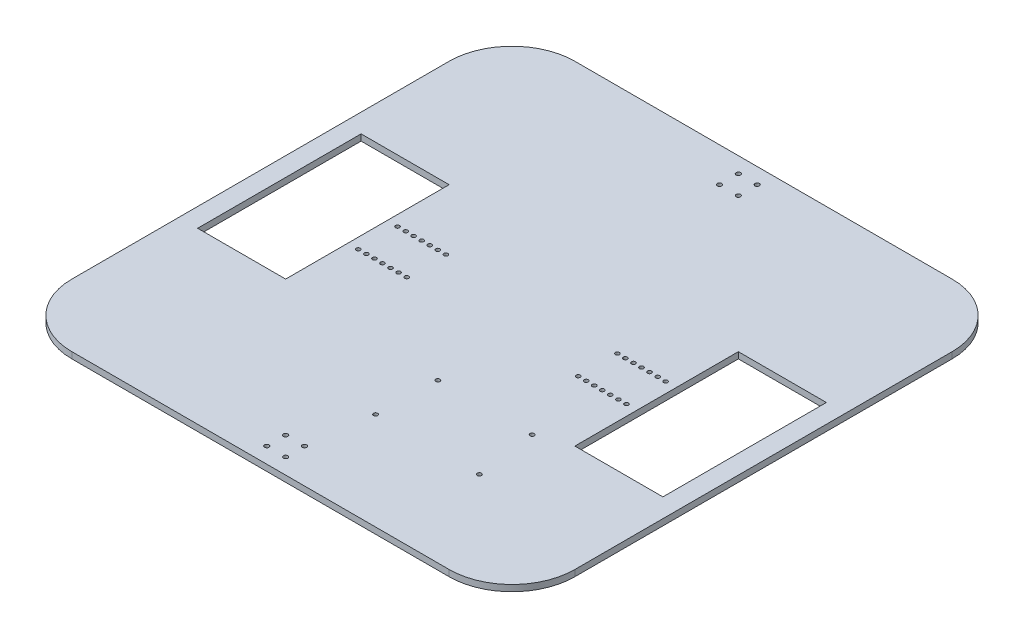
from build123d import *

# Parameters (mm, degrees)
SKETCH1_W           = 400
SKETCH1_H           = 400
SKETCH1_R           = 1.75
SKETCH1_W_2         = 70
SKETCH1_H_2         = 130
BOSS_EXTRUDE2_DEPTH = 5
FILLET1_R           = 50
SKETCH2_R           = 1.6
CUT_EXTRUDE1_DEPTH  = 5
SKETCH3_R           = 1.65
CUT_EXTRUDE2_DEPTH  = 10


with BuildPart() as part:
    # Sketch1 → Boss-Extrude2 (new body)
    with BuildSketch(Plane(origin=(0, 0, 0), x_dir=(1, 0, 0), z_dir=(0, 1, 0))):
        Rectangle(SKETCH1_W, SKETCH1_H)
        with Locations((-7.5, 172.5)):
            Circle(SKETCH1_R, mode=Mode.SUBTRACT)
        with Locations((-7.5, 187.5)):
            Circle(SKETCH1_R, mode=Mode.SUBTRACT)
        with Locations((7.5, 172.5)):
            Circle(SKETCH1_R, mode=Mode.SUBTRACT)
        with Locations((7.5, 187.5)):
            Circle(SKETCH1_R, mode=Mode.SUBTRACT)
        with Locations((-150, 0)):
            Rectangle(SKETCH1_W_2, SKETCH1_H_2, mode=Mode.SUBTRACT)
        with Locations((150, 0)):
            Rectangle(SKETCH1_W_2, SKETCH1_H_2, mode=Mode.SUBTRACT)
        with Locations((-7.5, -187.5)):
            Circle(SKETCH1_R, mode=Mode.SUBTRACT)
        with Locations((-7.5, -172.5)):
            Circle(SKETCH1_R, mode=Mode.SUBTRACT)
        with Locations((7.5, -187.5)):
            Circle(SKETCH1_R, mode=Mode.SUBTRACT)
        with Locations((7.5, -172.5)):
            Circle(SKETCH1_R, mode=Mode.SUBTRACT)
    extrude(amount=BOSS_EXTRUDE2_DEPTH)

    # Fillet1
    fillet1_edges = [part.edges().sort_by_distance(p)[0] for p in [
        (200, 2.5, -200),
        (200, 2.5, 200),
        (-200, 2.5, 200),
        (-200, 2.5, -200),
    ]]
    fillet(fillet1_edges, radius=FILLET1_R)

    # Sketch2 → Cut-Extrude1 (cut)
    with BuildSketch(Plane(origin=(0, 5, 0), x_dir=(1, 0, 0), z_dir=(0, 1, 0))):
        with Locations((-106.6, 15.6)):
            Circle(SKETCH2_R)
        with Locations((-100.2, 15.6)):
            Circle(SKETCH2_R)
        with Locations((-93.8, 15.6)):
            Circle(SKETCH2_R)
        with Locations((-87.4, 15.6)):
            Circle(SKETCH2_R)
        with Locations((-81, 15.6)):
            Circle(SKETCH2_R)
        with Locations((-74.6, 15.6)):
            Circle(SKETCH2_R)
        with Locations((-68.2, 15.6)):
            Circle(SKETCH2_R)
        with Locations((-68.2, -15.6)):
            Circle(SKETCH2_R)
        with Locations((-74.6, -15.6)):
            Circle(SKETCH2_R)
        with Locations((-81, -15.6)):
            Circle(SKETCH2_R)
        with Locations((-87.4, -15.6)):
            Circle(SKETCH2_R)
        with Locations((-93.8, -15.6)):
            Circle(SKETCH2_R)
        with Locations((-100.2, -15.6)):
            Circle(SKETCH2_R)
        with Locations((-106.6, -15.6)):
            Circle(SKETCH2_R)
        with Locations((68.2, -15.6)):
            Circle(SKETCH2_R)
        with Locations((74.6, -15.6)):
            Circle(SKETCH2_R)
        with Locations((81, -15.6)):
            Circle(SKETCH2_R)
        with Locations((87.4, -15.6)):
            Circle(SKETCH2_R)
        with Locations((93.8, -15.6)):
            Circle(SKETCH2_R)
        with Locations((100.2, -15.6)):
            Circle(SKETCH2_R)
        with Locations((106.6, -15.6)):
            Circle(SKETCH2_R)
        with Locations((68.2, 15.6)):
            Circle(SKETCH2_R)
        with Locations((74.6, 15.6)):
            Circle(SKETCH2_R)
        with Locations((81, 15.6)):
            Circle(SKETCH2_R)
        with Locations((87.4, 15.6)):
            Circle(SKETCH2_R)
        with Locations((93.8, 15.6)):
            Circle(SKETCH2_R)
        with Locations((100.2, 15.6)):
            Circle(SKETCH2_R)
        with Locations((106.6, 15.6)):
            Circle(SKETCH2_R)
    extrude(amount=-CUT_EXTRUDE1_DEPTH, mode=Mode.SUBTRACT)

    # Sketch3 → Cut-Extrude2 (cut)
    with BuildSketch(Plane(origin=(0, 5, 0), x_dir=(1, 0, 0), z_dir=(0, 1, 0))):
        with Locations((13.97, -122.46)):
            Circle(SKETCH3_R)
        with Locations((15.24, -74.2)):
            Circle(SKETCH3_R)
        with Locations((96.52, -122.46)):
            Circle(SKETCH3_R)
        with Locations((90.17, -74.2)):
            Circle(SKETCH3_R)
    extrude(amount=-CUT_EXTRUDE2_DEPTH, mode=Mode.SUBTRACT)


solid = part.part
